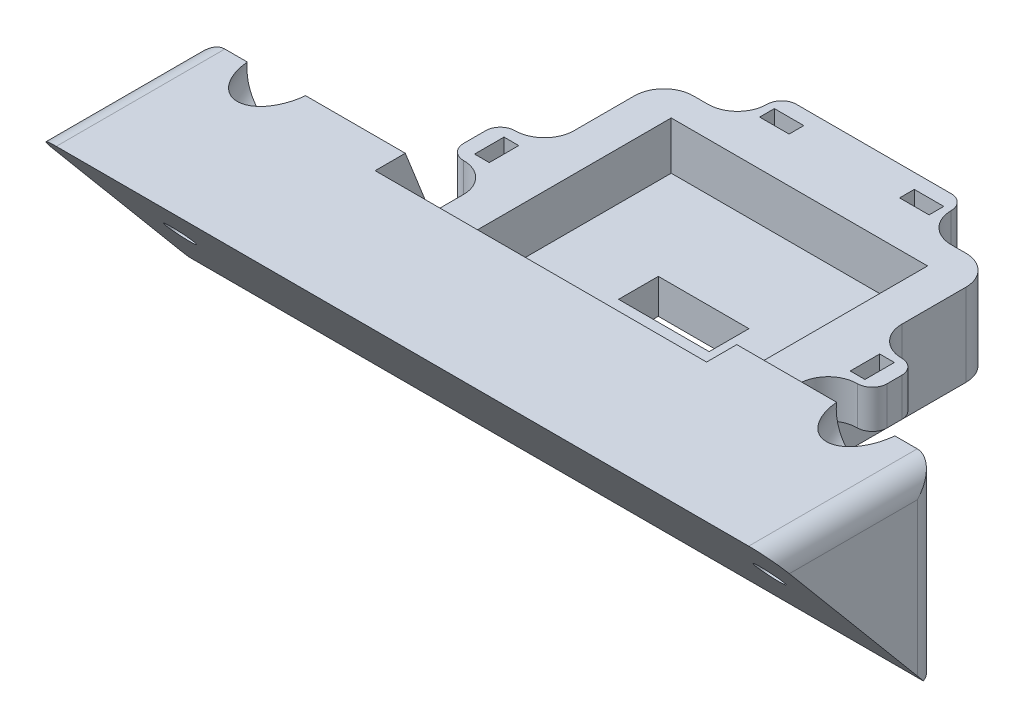
from build123d import *

# Parameters (mm, degrees)
SKETCH2_W           = 57.15
SKETCH2_H           = 49.784
BOSS_EXTRUDE1_DEPTH = 14.224
SKETCH3_W           = 44.196
SKETCH3_H           = 39.37
CUT_EXTRUDE1_DEPTH  = 8.255
SKETCH4_W           = 35.56
SKETCH4_H           = 4.191
SKETCH4_W_2         = 15.621
SKETCH4_H_2         = 6.858
CUT_EXTRUDE2_DEPTH  = 8.255
SKETCH5_W           = 7.62
SKETCH5_H           = 8.89
SKETCH5_H_2         = 7.62
BOSS_EXTRUDE2_DEPTH = 6.604
SKETCH6_W           = 2.54
SKETCH6_H           = 5.08
SKETCH6_W_2         = 5.08
SKETCH6_H_2         = 2.54
CUT_EXTRUDE3_DEPTH  = 6.604
FILLET1_R           = 5.08
FILLET2_R           = 2.54
SKETCH7_W           = 127
SKETCH7_H           = 14.224
SKETCH7_R           = 2.38125
BOSS_EXTRUDE3_DEPTH = 5.207
BOSS_EXTRUDE4_DEPTH = 127
SKETCH11_W          = 34.925
SKETCH11_H          = 11.176
BOSS_EXTRUDE5_DEPTH = 5.207
SKETCH9_R           = 2.413
CUT_EXTRUDE4_DEPTH  = 25.4
FILLET3_R           = 5.08
FILLET4_R           = 5.08
BOSS_EXTRUDE6_DEPTH = 6.35
BOSS_EXTRUDE7_DEPTH = 6.35
BOSS_EXTRUDE8_DEPTH = 127
BOSS_EXTRUDE9_DEPTH = 127
CUT_EXTRUDE6_START  = -1.945752886
SKETCH16_R          = 2.413
CUT_EXTRUDE6_DEPTH  = 1.945752886
CUT_EXTRUDE9_START  = -22.261352
SKETCH17_R          = 5.08
CUT_EXTRUDE9_DEPTH  = 12.101352
FILLET5_R           = 3.81


with BuildPart() as part:
    # Sketch2 → Boss-Extrude1 (new body)
    with BuildSketch(Plane(origin=(0, 0, 0), x_dir=(1, 0, 0), z_dir=(0, 1, 0))):
        with Locations((28.575, 24.892)):
            Rectangle(SKETCH2_W, SKETCH2_H)
    extrude(amount=BOSS_EXTRUDE1_DEPTH)

    # Sketch3 → Cut-Extrude1 (cut)
    with BuildSketch(Plane(origin=(0, 14.224, 0), x_dir=(1, 0, 0), z_dir=(0, 1, 0))):
        with Locations((28.575, 24.892)):
            Rectangle(SKETCH3_W, SKETCH3_H)
    extrude(amount=-CUT_EXTRUDE1_DEPTH, mode=Mode.SUBTRACT)

    # Sketch4 → Cut-Extrude2 (cut)
    with BuildSketch(Plane(origin=(0, 5.969, 0), x_dir=(1, 0, 0), z_dir=(0, 1, 0))):
        with Locations((28.575, 12.5095)):
            Rectangle(SKETCH4_W, SKETCH4_H)
        with Locations((28.575, 24.638)):
            Rectangle(SKETCH4_W_2, SKETCH4_H_2)
    extrude(amount=-CUT_EXTRUDE2_DEPTH, mode=Mode.SUBTRACT)

    # Sketch5 → Boss-Extrude2 (add)
    with BuildSketch(Plane(origin=(0, 14.224, 0), x_dir=(1, 0, 0), z_dir=(0, 1, 0))):
        with Locations((-3.81, 24.765)):
            Rectangle(SKETCH5_W, SKETCH5_H)
        Polygon((12.7, 49.784), (36.83, 49.784), (44.45, 49.784), (44.45, 57.404), (36.83, 57.404), (12.7, 57.404), align=None)
        with Locations((60.96, 24.765)):
            Rectangle(SKETCH5_W, SKETCH5_H_2)
    extrude(amount=-BOSS_EXTRUDE2_DEPTH)

    # Sketch6 → Cut-Extrude3 (cut)
    with BuildSketch(Plane(origin=(0, 14.224, 0), x_dir=(1, 0, 0), z_dir=(0, 1, 0))):
        with Locations((-3.81, 24.765)):
            Rectangle(SKETCH6_W, SKETCH6_H)
        with Locations((60.96, 24.765)):
            Rectangle(SKETCH6_W, SKETCH6_H)
        with Locations((16.51, 53.594)):
            Rectangle(SKETCH6_W_2, SKETCH6_H_2)
        with Locations((40.64, 53.594)):
            Rectangle(SKETCH6_W_2, SKETCH6_H_2)
    extrude(amount=-CUT_EXTRUDE3_DEPTH, mode=Mode.SUBTRACT)

    # Fillet1
    fillet1_edges = [part.edges().sort_by_distance(p)[0] for p in [
        (0, 7.112, -49.784),
        (57.15, 7.112, -49.784),
        (57.15, 7.112, 0),
        (0, 7.112, 0),
    ]]
    fillet(fillet1_edges, radius=FILLET1_R)

    # Fillet2
    fillet2_edges = [part.edges().sort_by_distance(p)[0] for p in [
        (-7.62, 10.922, -20.32),
        (-7.62, 10.922, -29.21),
        (12.7, 10.922, -57.404),
        (44.45, 10.922, -57.404),
        (64.77, 10.922, -28.575),
        (64.77, 10.922, -20.955),
    ]]
    fillet(fillet2_edges, radius=FILLET2_R)

    # Sketch7 → Boss-Extrude3 (add)
    with BuildSketch(Plane.XY):
        with Locations((28.575, 7.112)):
            Rectangle(SKETCH7_W, SKETCH7_H)
        with Locations((-30.861, 7.112)):
            Circle(SKETCH7_R, mode=Mode.SUBTRACT)
        with Locations((88.011, 7.112)):
            Circle(SKETCH7_R, mode=Mode.SUBTRACT)
    extrude(amount=-BOSS_EXTRUDE3_DEPTH)

    # Sketch8 → Boss-Extrude4 (add)
    with BuildSketch(Plane.ZY.offset(34.925)):
        Polygon((0, 25.4), (21.313130632, 25.4), (0, 0), (-5.207, 0), (-5.207, 14.224), (0, 14.224), align=None)
    extrude(amount=-BOSS_EXTRUDE4_DEPTH)

    # Sketch11 → Boss-Extrude5 (add)
    with BuildSketch(Plane(origin=(0, 0, 0), x_dir=(-1, 0, 0), z_dir=(0, 0, -1))):
        with Locations((17.4625, 19.812)):
            Rectangle(SKETCH11_W, SKETCH11_H)
        with Locations((-74.6125, 19.812)):
            Rectangle(SKETCH11_W, SKETCH11_H)
    extrude(amount=BOSS_EXTRUDE5_DEPTH)

    # Sketch9 → Cut-Extrude4 (cut, symmetric)
    with BuildSketch(Plane(origin=(0, 0, 0), x_dir=(1, 0, 0), z_dir=(0, -0.6427876096865434, 0.7660444431189748))):
        with Locations(Location((-22.225, 15.377345149, 0), (0, 0, 270))):
            Circle(SKETCH9_R)
        with Locations(Location((79.375, 15.377345149, 0), (0, 0, 270))):
            Circle(SKETCH9_R)
    extrude(amount=CUT_EXTRUDE4_DEPTH, both=True, mode=Mode.SUBTRACT)

    # Fillet3
    fillet3_edges = [part.edges().sort_by_distance(p)[0] for p in [
        (44.45, 10.922, -49.784),
        (12.7, 10.922, -49.784),
    ]]
    fillet(fillet3_edges, radius=FILLET3_R - 0.0001)  # a hair under: the kernel refuses the full size

    # Fillet4
    fillet4_edges = [part.edges().sort_by_distance(p)[0] for p in [
        (57.15, 10.922, -20.955),
        (57.15, 10.922, -28.575),
        (0, 10.922, -29.21),
        (0, 10.922, -20.32),
    ]]
    fillet(fillet4_edges, radius=FILLET4_R - 0.0001)  # a hair under: the kernel refuses the full size

    # Sketch12 → Boss-Extrude6 (add)
    with BuildSketch(Plane.ZY):
        Polygon((-5.207, 25.4), (-15.24, 0), (-5.207, 0), align=None)
    extrude(amount=BOSS_EXTRUDE6_DEPTH)

    # Sketch13 → Boss-Extrude7 (add)
    with BuildSketch(Plane(origin=(57.15, 0, 0), x_dir=(0, 0, -1), z_dir=(1, 0, 0))):
        Polygon((5.207, 25.4), (15.875, 0), (5.207, 0), align=None)
    extrude(amount=BOSS_EXTRUDE7_DEPTH)

    # Sketch14 → Boss-Extrude8 (add)
    with BuildSketch(Plane.ZY.offset(34.925)):
        Polygon((-5.207, 0), (-5.207, -6.205460957), (0, 0), align=None)
    extrude(amount=-BOSS_EXTRUDE8_DEPTH)

    # Sketch15 → Boss-Extrude9 (add)
    with BuildSketch(Plane(origin=(92.075, 0, 0), x_dir=(0, 0, -1), z_dir=(1, 0, 0))):
        Polygon((5.207, -6.205460957), (2.667, -6.205460957), (-23.853130632, 25.4), (-21.313130632, 25.4), align=None)
    extrude(amount=-BOSS_EXTRUDE9_DEPTH)

    # Sketch16 → Cut-Extrude6 (cut)
    with BuildSketch(Plane(origin=(0, 0, 0), x_dir=(-1, 0, 0), z_dir=(0, 0.6427876096865434, -0.7660444431189748)).offset(CUT_EXTRUDE6_START)):
        with Locations(Location((-79.375, 15.377345149, 0), (0, 0, 270))):
            Circle(SKETCH16_R)
        with Locations(Location((22.225, 15.377345149, 0), (0, 0, 270))):
            Circle(SKETCH16_R)
    extrude(amount=CUT_EXTRUDE6_DEPTH, mode=Mode.SUBTRACT)

    # Sketch17 → Cut-Extrude9 (cut)
    with BuildSketch(Plane(origin=(0, -1.250705846, 1.490533186), x_dir=(1, 0, 0), z_dir=(0, -0.6427876096865434, 0.7660444431189747)).offset(CUT_EXTRUDE9_START)):
        with Locations(Location((79.375, 15.377345149, 0), (0, 0, 171.701605742))):
            Circle(SKETCH17_R)
        with Locations(Location((-22.225, 15.377345149, 0), (0, 0, 8.298394258))):
            Circle(SKETCH17_R)
    extrude(amount=CUT_EXTRUDE9_DEPTH, mode=Mode.SUBTRACT)

    # Fillet5
    fillet5_edges = [part.edges().sort_by_distance(p)[0] for p in [
        (-34.925, 25.4, 9.323065316),
        (92.075, 25.4, 9.323065316),
        (92.075, 9.597269522, -5.207),
        (-34.925, 9.597269522, -5.207),
    ]]
    fillet(fillet5_edges, radius=FILLET5_R)


solid = part.part
